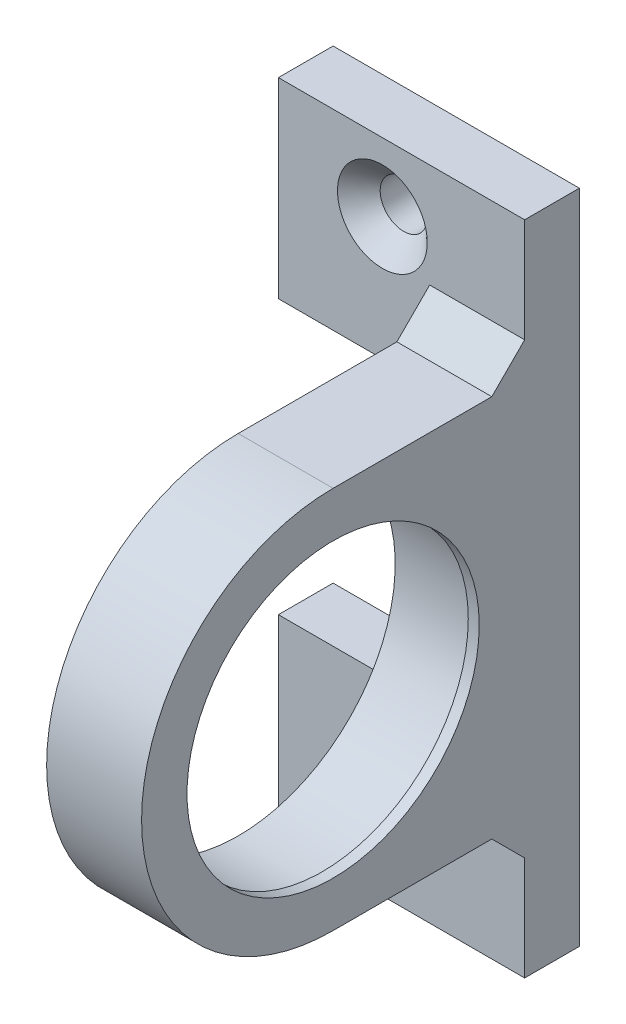
from build123d import *

# Parameters (mm, degrees)
SKETCH_2_W                     = 45
SKETCH_2_H                     = 60
SKETCH_2_W_2                   = 27.647058823
SKETCH_2_H_2                   = 25
EXTRUDE_2_DEPTH                = 5
SKETCH_4_W                     = 8.676470589
SKETCH_4_H                     = 35
SKETCH_4_W_2                   = 8.676470588
EXTRUDE_15_DEPTH               = 35
CUT_EXTRUDE_1_DEPTH            = 45
SKETCH_6_R                     = 14.35
CUT_EXTRUDE_2_DEPTH            = 45
FILLET_1_R                     = 5
SKETCH_7_R                     = 15
SKETCH_7_R_2                   = 13
EXTRUDE_16_DEPTH               = 1
SPLIT_BODIES_1_SURFACE_1_BACK  = 86
SPLIT_BODIES_1_SURFACE_1_DEPTH = 172
SPLIT_BODIES_1_SURFACE_2_BACK  = 86
SPLIT_BODIES_1_SURFACE_2_DEPTH = 172
HOLE_WIZARD_1_D                = 4.3
HOLE_WIZARD_1_DEPTH            = 5
HOLE_WIZARD_1_CSINK_D          = 8.2
HOLE_WIZARD_1_CSINK_ANGLE      = 90
HOLE_WIZARD_1_TIP              = 1.291850331
EXTRUDE_START                  = -1
SKETCH_14_R                    = 14.35
SKETCH_14_R_2                  = 13.35
EXTRUDE_1_DEPTH                = 1
CHAMFER_1_SIZE                 = 3


with BuildPart() as part:
    # 草图2 → 凸台-拉伸2 (new body)
    with BuildSketch(Plane.XY):
        with Locations((7.726423565, -5.661764706)):
            Rectangle(SKETCH_2_W, SKETCH_2_H)
        with Locations((7.726423565, -5.661764706)):
            Rectangle(SKETCH_2_W_2, SKETCH_2_H_2, mode=Mode.SUBTRACT)
    extrude(amount=EXTRUDE_2_DEPTH)

    # 草图4 → 凸台-拉伸15 (add)
    with BuildSketch(Plane.XY.offset(5)):
        with Locations((-10.435341141, -5.661764706)):
            Rectangle(SKETCH_4_W, SKETCH_4_H)
        with Locations((25.888188271, -5.661764706)):
            Rectangle(SKETCH_4_W_2, SKETCH_4_H)
    extrude(amount=EXTRUDE_15_DEPTH)

    # 草图5 → 切除-拉伸1 (cut)
    with BuildSketch(Plane.ZY.offset(14.773576435)):
        with BuildLine():
            ThreePointArc((22.5, 11.838235294), (34.874368671, 6.712603965), (40, -5.661764706))
            Line((40, -5.661764706), (40, 11.838235294))
            Line((40, 11.838235294), (22.5, 11.838235294))
        make_face()
        with BuildLine():
            Line((40, -23.161764706), (40, -5.661764706))
            ThreePointArc((40, -5.661764706), (34.874368671, -18.036133377), (22.5, -23.161764706))
            Line((22.5, -23.161764706), (40, -23.161764706))
        make_face()
    extrude(amount=-CUT_EXTRUDE_1_DEPTH, mode=Mode.SUBTRACT)

    # 草图6 → 切除-拉伸2 (cut)
    with BuildSketch(Plane.ZY.offset(14.773576435)):
        with Locations((22.5, -5.661764706)):
            Circle(SKETCH_6_R)
    extrude(amount=-CUT_EXTRUDE_2_DEPTH, mode=Mode.SUBTRACT)

    # 圆角1
    fillet_1_edges = [part.edges().sort_by_distance(p)[0] for p in [
        (-6.097105846, 6.838235294, 2.5),
        (21.549952977, 6.838235294, 2.5),
        (-6.097105846, -18.161764706, 2.5),
        (21.549952977, -18.161764706, 2.5),
    ]]
    fillet(fillet_1_edges, radius=FILLET_1_R)

    # 草图7 → 凸台-拉伸16 (add)
    with BuildSketch(Plane(origin=(-6.097105846, 0, 0), x_dir=(0, 0, -1), z_dir=(1, 0, 0))):
        with Locations((-22.5, -5.661764706)):
            Circle(SKETCH_7_R)
        with Locations((-22.5, -5.661764706)):
            Circle(SKETCH_7_R_2, mode=Mode.SUBTRACT)
    extrude(amount=-EXTRUDE_16_DEPTH)


with BuildPart() as body_2:
    # Split Bodies 1: the piece behind the surface
    add(part.part)
    # Split Bodies 1 surface: a surface, the sketch's curves swept straight by 172 mm
    with BuildLine(Plane.XY.offset(5).offset(-SPLIT_BODIES_1_SURFACE_1_BACK), mode=Mode.PRIVATE) as split_bodies_1_surface_1_path:
        Line((7.726423565, 24.338235294), (7.726423565, -35.661764706))
    split_bodies_1_surface_1 = Shell.extrude(split_bodies_1_surface_1_path.wire(), (0 * SPLIT_BODIES_1_SURFACE_1_DEPTH, 0 * SPLIT_BODIES_1_SURFACE_1_DEPTH, 1 * SPLIT_BODIES_1_SURFACE_1_DEPTH))
    split(bisect_by=split_bodies_1_surface_1, keep=Keep.BOTTOM)


with BuildPart() as part_1:
    add(part.part)

    # Split Bodies 1: split by a surface, the side it looks to stays
    # Split Bodies 1 surface: a surface, the sketch's curves swept straight by 172 mm
    with BuildLine(Plane.XY.offset(5).offset(-SPLIT_BODIES_1_SURFACE_2_BACK), mode=Mode.PRIVATE) as split_bodies_1_surface_2_path:
        Line((7.726423565, 24.338235294), (7.726423565, -35.661764706))
    split_bodies_1_surface_2 = Shell.extrude(split_bodies_1_surface_2_path.wire(), (0 * SPLIT_BODIES_1_SURFACE_2_DEPTH, 0 * SPLIT_BODIES_1_SURFACE_2_DEPTH, 1 * SPLIT_BODIES_1_SURFACE_2_DEPTH))
    split(bisect_by=split_bodies_1_surface_2, keep=Keep.TOP)

    # 打孔尺寸(%根据)内六角花形半沉头螺钉的类型1
    with Locations(Plane(origin=(17.226423565, 18.088235294, 5), x_dir=(1, 0, 0), z_dir=(0, 0, 1))):
        with Locations((0, 0), (0, -47.5)):
            CounterSinkHole(HOLE_WIZARD_1_D / 2, HOLE_WIZARD_1_CSINK_D / 2, depth=HOLE_WIZARD_1_DEPTH, counter_sink_angle=HOLE_WIZARD_1_CSINK_ANGLE)
            with Locations((0, 0, -(HOLE_WIZARD_1_DEPTH + HOLE_WIZARD_1_TIP / 2))):  # 118° drill point
                Cone(0, HOLE_WIZARD_1_D / 2, HOLE_WIZARD_1_TIP, mode=Mode.SUBTRACT)

    # 草图14 → 拉伸-薄壁1 (add)
    with BuildSketch(Plane(origin=(30.226423565, 0, 0), x_dir=(0, 0, -1), z_dir=(1, 0, 0)).offset(EXTRUDE_START)):
        with Locations((-22.5, -5.661764706)):
            Circle(SKETCH_14_R)
        with Locations((-22.5, -5.661764706)):
            Circle(SKETCH_14_R_2, mode=Mode.SUBTRACT)
    extrude(amount=EXTRUDE_1_DEPTH)

    # 倒角1
    chamfer_1_edges = [part_1.edges().sort_by_distance(p)[0] for p in [
        (25.888188271, -23.161764706, 5),
        (25.888188271, 11.838235294, 5),
    ]]
    chamfer(chamfer_1_edges, length=CHAMFER_1_SIZE)


solid = part_1.part
